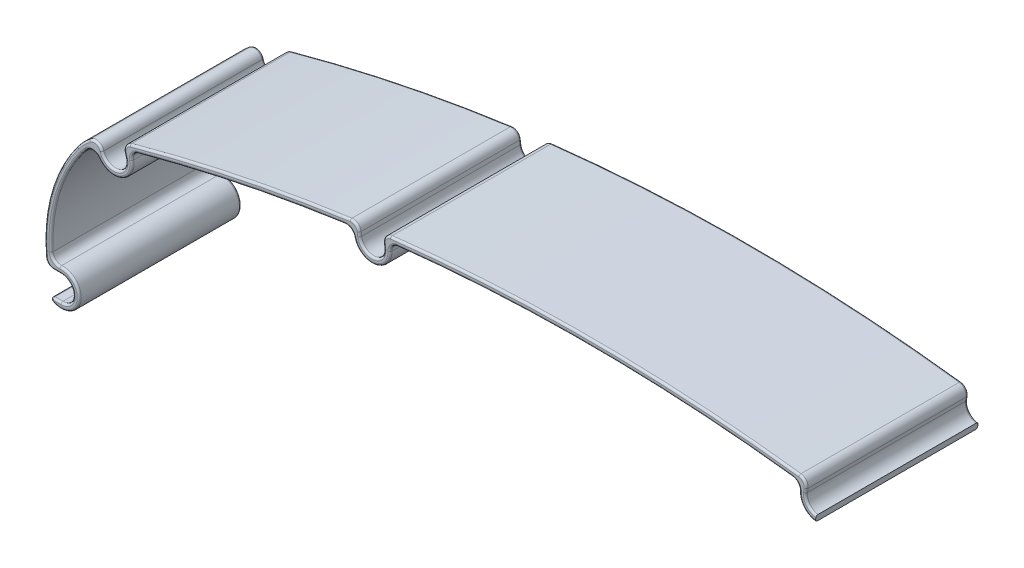
from build123d import *
from build123d.topology import SkipClean

# Parameters (mm, degrees)
EXTRUDE_1_DEPTH     = 40
SKETCH_2_R          = 3
EXTRUDE_1_2_DEPTH   = 40
EXTRUDE_2_DEPTH     = 40
CUT_EXTRUDE_2_DEPTH = 208.592060428
FILLET_1_R          = 2
FILLET_3_R          = 0.5
FILLET_4_R          = 0.5
CUT_EXTRUDE_3_DEPTH = 207.611727306


with BuildPart() as part:
    # ｽｹｯﾁ1 → Extrude 1 (new body)
    with BuildSketch(Plane.XY):
        with BuildLine():
            ThreePointArc((-174.917675812, 6.802025891), (-175.16536545, 24.049389715), (-168.029000204, 39.753058081))
            ThreePointArc((-168.029000204, 39.753058081), (-164.386404751, 43.234236237), (-159.829079223, 45.38316318))
            ThreePointArc((-159.829079223, 45.38316318), (-73.039152779, 60.834071576), (15.071759596, 58.061162838))
            ThreePointArc((15.071759596, 58.061162838), (38.698282136, 56.368912879), (62.348129133, 57.695945012))
            ThreePointArc((62.348129133, 57.695945012), (64.982359088, 58.386614212), (67.332573283, 59.762362967))
            ThreePointArc((67.332573283, 59.762362967), (68.437320119, 60.625078199), (69.547541148, 61.480737248))
            ThreePointArc((69.547541148, 61.480737248), (69.829795591, 61.819116287), (69.939206591, 62.245961901))
            ThreePointArc((69.939206591, 62.245961901), (71.148233251, 64.567309568), (73.719523874, 65.056047728))
            ThreePointArc((73.719523874, 65.056047728), (74.15979094, 65.03780341), (74.565156848, 65.21056459))
            ThreePointArc((74.565156848, 65.21056459), (113.346908434, 87.575280448), (155.853132865, 101.626104486))
            ThreePointArc((155.853132865, 101.626104486), (158.26218824, 101.124572816), (159.485666507, 98.989582711))
            ThreePointArc((159.485666507, 98.989582711), (159.562144442, 78.779630656), (155.859832877, 58.911543179))
            Line((155.859832877, 58.911543179), (154.417522154, 59.323538057))
            ThreePointArc((154.417522154, 59.323538057), (158.068245541, 78.914782698), (157.992833254, 98.843128361))
            ThreePointArc((157.992833254, 98.843128361), (157.38109412, 99.910623413), (156.176566433, 100.161389249))
            ThreePointArc((156.176566433, 100.161389249), (113.960157168, 86.206366284), (75.442826616, 63.994137124))
            ThreePointArc((75.442826616, 63.994137124), (74.429411845, 63.562234175), (73.32874418, 63.607844969))
            ThreePointArc((73.32874418, 63.607844969), (72.043098868, 63.363475889), (71.438585538, 62.202802056))
            ThreePointArc((71.438585538, 62.202802056), (71.165058039, 61.135688021), (70.459421932, 60.289740423))
            ThreePointArc((70.459421932, 60.289740423), (69.356770591, 59.439915413), (68.259556121, 58.583082331))
            ThreePointArc((68.259556121, 58.583082331), (65.556810089, 57.000971383), (62.527445976, 56.206701758))
            ThreePointArc((62.527445976, 56.206701758), (38.68669584, 54.868957627), (14.869458419, 56.574867365))
            ThreePointArc((14.869458419, 56.574867365), (-72.930878607, 59.337984435), (-159.414875998, 43.941485058))
            ThreePointArc((-159.414875998, 43.941485058), (-163.537227688, 41.997749947), (-166.832146939, 38.848877645))
            ThreePointArc((-166.832146939, 38.848877645), (-173.697107608, 23.742438725), (-173.458837906, 7.151012945))
            Line((-173.458837906, 7.151012945), (-174.917675812, 6.802025891))
        make_face()
    extrude(amount=EXTRUDE_1_DEPTH)

    # ｽｹｯﾁ2 → Extrude 1 2 (add, through all)
    with BuildSketch(Plane.XY):
        with Locations((156.5, 98.696674011)):
            Circle(SKETCH_2_R)
        with Locations((152.975211431, 59.735532934)):
            Circle(SKETCH_2_R)
        with Locations((72.937964485, 62.15964221)):
            Circle(SKETCH_2_R)
        with Locations((14.667154113, 55.08857315)):
            Circle(SKETCH_2_R)
        with Locations((-95.332845887, 55.602740192)):
            Circle(SKETCH_2_R)
        with Locations((-159, 42.5)):
            Circle(SKETCH_2_R)
        with Locations((-172, 7.5)):
            Circle(SKETCH_2_R)
    extrude(amount=EXTRUDE_1_2_DEPTH)

    # ｽｹｯﾁ3 → ﾎﾞｽ - 押し出し2 (add, through all)
    with SkipClean():  # the faces are left unmerged after this step: merging them gives an invalid solid
        with BuildSketch(Plane.XY.offset(40)):
            with BuildLine():
                ThreePointArc((155.105149564, 61.848200335), (155.309814131, 62.650779102), (155.508210181, 63.454930376))
                ThreePointArc((155.508210181, 63.454930376), (148.997241196, 57.631785608), (157.475211431, 59.735532934))
                ThreePointArc((157.475211431, 59.735532934), (157.288117426, 61.019605313), (156.742392819, 62.196903362))
                ThreePointArc((156.742392819, 62.196903362), (156.314091206, 60.550736841), (155.859832877, 58.911543179))
                ThreePointArc((155.859832877, 58.911543179), (150.069623581, 58.988834035), (155.105149564, 61.848200335))
            make_face()
            with BuildLine():
                ThreePointArc((156.742392819, 62.196903362), (156.187488729, 62.886925414), (155.508210181, 63.454930376))
                ThreePointArc((155.508210181, 63.454930376), (155.309814131, 62.650779102), (155.105149564, 61.848200335))
                ThreePointArc((155.105149564, 61.848200335), (150.069623581, 58.988834035), (155.859832877, 58.911543179))
                ThreePointArc((155.859832877, 58.911543179), (156.314091206, 60.550736841), (156.742392819, 62.196903362))
            make_face()
            with BuildLine():
                ThreePointArc((153.634250899, 99.584075889), (152.831051821, 99.395038452), (152.028572351, 99.202969162))
                ThreePointArc((152.028572351, 99.202969162), (153.837741702, 95.068674458), (158.324352301, 94.583069912))
                ThreePointArc((158.324352301, 94.583069912), (158.27349835, 95.409770667), (158.216195446, 96.236049458))
                ThreePointArc((158.216195446, 96.236049458), (154.730059706, 96.274420648), (153.634250899, 99.584075889))
            make_face()
            with BuildLine():
                ThreePointArc((70.459421932, 60.289740423), (69.906180844, 59.864751513), (69.354299522, 59.437998327))
                ThreePointArc((69.354299522, 59.437998327), (74.373845341, 57.894874202), (77.437964485, 62.15964221))
                ThreePointArc((77.437964485, 62.15964221), (77.217292333, 63.55153056), (76.576918629, 64.806907354))
                ThreePointArc((76.576918629, 64.806907354), (76.009223863, 64.40142748), (75.442826616, 63.994137124))
                ThreePointArc((75.442826616, 63.994137124), (75.399998918, 63.963913966), (75.356546973, 63.934595379))
                ThreePointArc((75.356546973, 63.934595379), (74.72769572, 59.751974852), (70.541302553, 60.35520003))
                ThreePointArc((70.541302553, 60.35520003), (70.500705388, 60.322041001), (70.459421932, 60.289740423))
            make_face()
            with BuildLine():
                ThreePointArc((12.289483713, 56.91796744), (11.472492469, 57.023256633), (10.655298124, 57.126957688))
                ThreePointArc((10.655298124, 57.126957688), (13.619144559, 50.712310364), (19.167154113, 55.08857315))
                ThreePointArc((19.167154113, 55.08857315), (19.140980955, 55.573210523), (19.062765943, 56.052210345))
                ThreePointArc((19.062765943, 56.052210345), (18.249123765, 56.1461181), (17.435899956, 56.243582438))
                ThreePointArc((17.435899956, 56.243582438), (14.277367269, 52.114003228), (12.289483713, 56.91796744))
            make_face()
            with BuildLine():
                ThreePointArc((-98.102305571, 56.756036796), (-98.918773563, 56.646764089), (-99.735027626, 56.535904666))
                ThreePointArc((-99.735027626, 56.535904666), (-95.801984552, 51.127261568), (-90.832845887, 55.602740192))
                ThreePointArc((-90.832845887, 55.602740192), (-90.951732307, 56.630282793), (-91.302109797, 57.603531678))
                ThreePointArc((-91.302109797, 57.603531678), (-92.120237861, 57.507474522), (-92.938177679, 57.409827398))
                ThreePointArc((-92.938177679, 57.409827398), (-94.956046603, 52.626497208), (-98.102305571, 56.756036796))
            make_face()
            with BuildLine():
                ThreePointArc((-161.968675598, 42.932394718), (-162.736296322, 42.509116787), (-163.47635635, 42.039311575))
                ThreePointArc((-163.47635635, 42.039311575), (-158.769352625, 38.0059148), (-154.5, 42.5))
                ThreePointArc((-154.5, 42.5), (-154.710957632, 43.861659124), (-155.324051364, 45.095650521))
                ThreePointArc((-155.324051364, 45.095650521), (-156.117747866, 44.875181143), (-156.911014356, 44.653169519))
                ThreePointArc((-156.911014356, 44.653169519), (-158.033702901, 39.659882059), (-161.968675598, 42.932394718))
            make_face()
            with BuildLine():
                ThreePointArc((-175.578603832, 10.228295184), (-173.439840747, 3.236567272), (-167.5, 7.5))
                ThreePointArc((-167.5, 7.5), (-169.737135307, 11.389658518), (-174.224197059, 11.411898189))
                ThreePointArc((-174.224197059, 11.411898189), (-174.113884067, 10.579249836), (-173.985166515, 9.74924741))
                ThreePointArc((-173.985166515, 9.74924741), (-169.139756236, 6.595010712), (-174.917675812, 6.802025891))
                ThreePointArc((-174.917675812, 6.802025891), (-175.286049309, 8.50784779), (-175.578603832, 10.228295184))
            make_face()
            with BuildLine():
                ThreePointArc((-173.985166515, 9.74924741), (-174.113884067, 10.579249836), (-174.224197059, 11.411898189))
                ThreePointArc((-174.224197059, 11.411898189), (-174.961140585, 10.888457825), (-175.578603832, 10.228295184))
                ThreePointArc((-175.578603832, 10.228295184), (-175.286049309, 8.50784779), (-174.917675812, 6.802025891))
                ThreePointArc((-174.917675812, 6.802025891), (-169.139756236, 6.595010712), (-173.985166515, 9.74924741))
            make_face()
            with BuildLine():
                ThreePointArc((-174.917675812, 6.802025891), (-169.139756236, 6.595010712), (-173.985166515, 9.74924741))
                ThreePointArc((-173.985166515, 9.74924741), (-173.403193785, 25.035153743), (-166.832146939, 38.848877645))
                ThreePointArc((-166.832146939, 38.848877645), (-164.631459446, 41.165814703), (-161.968675598, 42.932394718))
                ThreePointArc((-161.968675598, 42.932394718), (-158.033702901, 39.659882059), (-156.911014356, 44.653169519))
                ThreePointArc((-156.911014356, 44.653169519), (-127.721253028, 51.747326401), (-98.102305571, 56.756036796))
                ThreePointArc((-98.102305571, 56.756036796), (-94.956046603, 52.626497208), (-92.938177679, 57.409827398))
                ThreePointArc((-92.938177679, 57.409827398), (-40.309022297, 60.442434008), (12.289483713, 56.91796744))
                ThreePointArc((12.289483713, 56.91796744), (14.277367269, 52.114003228), (17.435899956, 56.243582438))
                ThreePointArc((17.435899956, 56.243582438), (39.98055891, 54.863431307), (62.527445397, 56.206701272))
                ThreePointArc((62.527445397, 56.206701272), (65.556809954, 57.000970881), (68.259556248, 58.583082168))
                ThreePointArc((68.259556248, 58.583082168), (69.356770591, 59.439915413), (70.459421932, 60.289740423))
                ThreePointArc((70.459421932, 60.289740423), (70.500705388, 60.322041001), (70.541302553, 60.35520003))
                ThreePointArc((70.541302553, 60.35520003), (74.72769572, 59.751974852), (75.356546973, 63.934595379))
                ThreePointArc((75.356546973, 63.934595379), (75.399998918, 63.963913966), (75.442826616, 63.994137124))
                ThreePointArc((75.442826616, 63.994137124), (112.772142039, 85.669896417), (153.634250899, 99.584075889))
                ThreePointArc((153.634250899, 99.584075889), (154.730059706, 96.274420648), (158.216195446, 96.236049458))
                ThreePointArc((158.216195446, 96.236049458), (158.068245541, 78.914782698), (155.105149564, 61.848200335))
                ThreePointArc((155.105149564, 61.848200335), (150.069623581, 58.988834035), (155.859832877, 58.911543179))
                ThreePointArc((155.859832877, 58.911543179), (159.562144442, 78.779630656), (159.485666507, 98.989582711))
                ThreePointArc((159.485666507, 98.989582711), (158.26218824, 101.124572816), (155.853132865, 101.626104486))
                ThreePointArc((155.853132865, 101.626104486), (113.346908434, 87.575280448), (74.565156848, 65.21056459))
                ThreePointArc((74.565156848, 65.21056459), (74.15979094, 65.03780341), (73.719523874, 65.056047728))
                ThreePointArc((73.719523874, 65.056047728), (71.148233251, 64.567309568), (69.939206591, 62.245961901))
                ThreePointArc((69.939206591, 62.245961901), (69.829795591, 61.819116287), (69.547541148, 61.480737248))
                ThreePointArc((69.547541148, 61.480737248), (68.437320119, 60.625078199), (67.332573283, 59.762362967))
                ThreePointArc((67.332573283, 59.762362967), (64.982359088, 58.386614212), (62.348129133, 57.695945012))
                ThreePointArc((62.348129133, 57.695945012), (38.698282167, 56.368913497), (15.07175968, 58.061163451))
                ThreePointArc((15.07175968, 58.061163451), (-73.039152866, 60.83407219), (-159.829079451, 45.383163973))
                ThreePointArc((-159.829079451, 45.383163973), (-164.386405219, 43.234236917), (-168.029000204, 39.753058081))
                ThreePointArc((-168.029000204, 39.753058081), (-175.16536545, 24.049389715), (-174.917675812, 6.802025891))
            make_face()
        extrude(amount=-EXTRUDE_2_DEPTH)
    add(part.part.scale(1), mode=Mode.REPLACE)  # the faces are merged on a copy

    # ｽｹｯﾁ4 → ｶｯﾄ - 押し出し2 (cut, through all)
    with BuildSketch(Plane.XY.offset(40)):
        with BuildLine():
            Line((-161.881126724, 41.663872737), (-162.717256801, 44.545009155))
            ThreePointArc((-162.717256801, 44.545009155), (-160.67225734, 48.262263142), (-156.955003353, 46.217263682))
            Line((-156.955003353, 46.217263682), (-156.118873276, 43.336127263))
            ThreePointArc((-156.118873276, 43.336127263), (-158.163872737, 39.618873276), (-161.881126724, 41.663872737))
        make_face()
        with BuildLine():
            Line((-172, 4.5), (-176.5, 4.5))
            ThreePointArc((-176.5, 4.5), (-179.5, 7.5), (-176.5, 10.5))
            Line((-176.5, 10.5), (-172, 10.5))
            ThreePointArc((-172, 10.5), (-169, 7.5), (-172, 4.5))
        make_face()
        with BuildLine():
            Line((-98.309088871, 55.225940908), (-98.685888052, 58.202183073))
            ThreePointArc((-98.685888052, 58.202183073), (-96.086444352, 61.555225341), (-92.733402084, 58.955781642))
            Line((-92.733402084, 58.955781642), (-92.356602903, 55.979539476))
            ThreePointArc((-92.356602903, 55.979539476), (-94.956046603, 52.626497208), (-98.309088871, 55.225940908))
        make_face()
        with BuildLine():
            Line((11.694563608, 55.493178744), (12.099169116, 58.465768619))
            ThreePointArc((12.099169116, 58.465768619), (15.476365216, 61.03375353), (18.044350127, 57.65655743))
            Line((18.044350127, 57.65655743), (17.639744618, 54.683967555))
            ThreePointArc((17.639744618, 54.683967555), (14.262548518, 52.115982644), (11.694563608, 55.493178744))
        make_face()
        with BuildLine():
            Line((70.530297127, 60.369910976), (68.740565893, 62.777578334))
            ThreePointArc((68.740565893, 62.777578334), (69.358502016, 66.974976927), (73.555900609, 66.357040803))
            Line((73.555900609, 66.357040803), (75.345631843, 63.949373445))
            ThreePointArc((75.345631843, 63.949373445), (74.72769572, 59.751974852), (70.530297127, 60.369910976))
        make_face()
        with BuildLine():
            Line((154.072101195, 100.458862251), (155.834289436, 102.886761056))
            ThreePointArc((155.834289436, 102.886761056), (160.024376481, 103.55247162), (160.690087045, 99.362384575))
            Line((160.690087045, 99.362384575), (158.927898805, 96.934485771))
            ThreePointArc((158.927898805, 96.934485771), (154.73781176, 96.268775206), (154.072101195, 100.458862251))
        make_face()
        with BuildLine():
            Line((152.975211431, 62.735532934), (157.475211431, 62.735532934))
            ThreePointArc((157.475211431, 62.735532934), (160.475211431, 59.735532934), (157.475211431, 56.735532934))
            Line((157.475211431, 56.735532934), (152.975211431, 56.735532934))
            ThreePointArc((152.975211431, 56.735532934), (149.975211431, 59.735532934), (152.975211431, 62.735532934))
        make_face()
    extrude(amount=-CUT_EXTRUDE_2_DEPTH, mode=Mode.SUBTRACT)

    # ﾌｨﾚｯﾄ1
    fillet_1_edges = [part.edges().sort_by_distance(p)[0] for p in [
        (-174.224197059, 11.411898189, 20),
        (-155.324051364, 45.095650521, 20),
        (-99.735027626, 56.535904666, 20),
        (-91.302109797, 57.603531678, 20),
        (10.655298124, 57.126957688, 20),
        (19.062765943, 56.052210345, 20),
        (69.354299522, 59.437998327, 20),
        (76.576918629, 64.806907354, 20),
        (152.028572351, 99.202969162, 20),
        (158.324352301, 94.583069912, 20),
        (155.508210181, 63.454930376, 20),
        (156.876524055, 62.735532934, 20),
        (159.591463431, 97.848728486, 20),
        (154.738438299, 101.376924818, 20),
        (74.458181594, 65.14323147, 20),
        (69.642846878, 61.563769001, 20),
        (18.047519346, 57.680566039, 20),
        (12.0977422, 58.455285231, 20),
        (-92.732073243, 58.945285465, 20),
        (-98.684559207, 58.191686864, 20),
        (-156.950021623, 46.200097642, 20),
        (-162.638748681, 44.274485931, 20),
        (-175.617677363, 10.5, 20),
        (-163.47635635, 42.039311575, 20),
    ]]
    fillet(fillet_1_edges, radius=FILLET_1_R)

    # ﾌｨﾚｯﾄ3
    fillet_3_edges = [part.edges().sort_by_distance(p)[0] for p in [
        (-175.354101966, 4.5, 20),
        (156.329313397, 56.735532934, 20),
    ]]
    fillet(fillet_3_edges, radius=FILLET_3_R)

    # ﾌｨﾚｯﾄ4
    fillet_4_edges = [part.edges().sort_by_distance(p)[0] for p in [
        (-172.852772551, 27.036503028, 40),
        (-172.852772551, 27.036503028, 0),
        (-174.496755599, 26.76353818, 40),
        (64.982359088, 58.386614212, 40),
        (41.171934255, 56.366268849, 40),
        (37.32663542, 54.884402397, 40),
        (-156.25241115, 43.796271973, 40),
        (-158.163872737, 39.618873276, 40),
        (-156.25241115, 43.796271973, 0),
        (-158.163872737, 39.618873276, 0),
        (-172.919038538, 10.5, 0),
        (-172.919038538, 10.5, 40),
        (-169, 7.5, 40),
        (-169, 7.5, 0),
        (-92.4175483, 56.460931868, 40),
        (-94.956046603, 52.626497208, 40),
        (-92.4175483, 56.460931868, 0),
        (-94.956046603, 52.626497208, 0),
        (14.262548518, 52.115982644, 40),
        (17.711667491, 55.212376579, 40),
        (14.262548518, 52.115982644, 0),
        (17.711667491, 55.212376579, 0),
        (149.975211431, 59.735532934, 40),
        (153.943457268, 56.735532934, 40),
        (149.975211431, 59.735532934, 0),
        (153.943457268, 56.735532934, 0),
        (-157.222222844, 38.366054139, 40),
        (-157.222222844, 38.366054139, 0),
        (-127.7212524, 51.747326519, 0),
        (-127.7212524, 51.747326519, 40),
        (-94.85985575, 51.127666971, 40),
        (-94.85985575, 51.127666971, 0),
        (-40.309022297, 60.442434008, 0),
        (-40.309022297, 60.442434008, 40),
        (14.115637874, 50.62249771, 40),
        (14.115637874, 50.62249771, 0),
        (65.429568152, 56.949108434, 40),
        (65.429568152, 56.949108434, 0),
        (75.621371199, 58.547256792, 40),
        (75.621371199, 58.547256792, 0),
        (112.400183249, 85.500173809, 0),
        (112.400183249, 85.500173809, 40),
        (153.827551561, 95.076174137, 40),
        (153.827551561, 95.076174137, 0),
        (158.068245541, 78.914782698, 0),
        (158.068245541, 78.914782698, 40),
        (148.538237858, 58.985022768, 40),
        (148.538237858, 58.985022768, 0),
        (159.585920071, 79.046123951, 0),
        (159.585920071, 79.046123951, 40),
        (-166.634814433, 41.359610926, 0),
        (-161.890971039, 41.697794272, 0),
        (-128.024778685, 53.216297373, 0),
        (-98.370034264, 55.707333273, 0),
        (-40.302010998, 61.942418726, 0),
        (11.760006542, 55.973980411, 0),
        (67.692381882, 60.044588841, 0),
        (74.72769572, 59.751974852, 0),
        (111.949802025, 86.943547277, 0),
        (154.723182233, 96.279461024, 0),
        (154.13630839, 62.735532934, 0),
        (-166.307123073, 39.502792681, 0),
        (-175.18499823, 11.021553718, 0),
        (-163.196649172, 43.074160345, 0),
        (-156.21061286, 45.790321687, 0),
        (-99.199108533, 57.525374806, 0),
        (-92.067706458, 58.428226942, 0),
        (11.428570831, 57.944459992, 0),
        (18.533672833, 57.046818746, 0),
        (69.440025994, 60.742330955, 0),
        (75.303219572, 65.100715699, 0),
        (152.715168975, 100.150386551, 0),
        (159.026732407, 95.51117627, 0),
        (156.542606194, 63.17045311, 0),
        (154.13630839, 62.735532934, 40),
        (-166.307123073, 39.502792681, 40),
        (154.723182233, 96.279461024, 40),
        (111.949802025, 86.943547277, 40),
        (74.72769572, 59.751974852, 40),
        (67.692381882, 60.044588841, 40),
        (11.760006542, 55.973980411, 40),
        (-40.302010998, 61.942418726, 40),
        (-98.370034264, 55.707333273, 40),
        (-128.024778685, 53.216297373, 40),
        (-161.890971039, 41.697794272, 40),
        (-166.634814433, 41.359610926, 40),
        (-175.18499823, 11.021553718, 40),
        (-163.196649172, 43.074160345, 40),
        (-156.21061286, 45.790321687, 40),
        (-99.199108533, 57.525374806, 40),
        (-92.067706458, 58.428226942, 40),
        (11.428570831, 57.944459992, 40),
        (18.533672833, 57.046818746, 40),
        (69.440025994, 60.742330955, 40),
        (75.303219572, 65.100715699, 40),
        (152.715168975, 100.150386551, 40),
        (159.026732407, 95.51117627, 40),
        (156.542606194, 63.17045311, 40),
        (-173.768568414, 12.485677184, 40),
        (-173.768568414, 12.485677184, 0),
        (-154.322969262, 44.816153309, 40),
        (-154.322969262, 44.816153309, 0),
        (-100.544388476, 55.883817911, 40),
        (-100.544388476, 55.883817911, 0),
        (-90.355778022, 57.17371948, 40),
        (-90.355778022, 57.17371948, 0),
        (9.704989693, 56.706010853, 40),
        (9.704989693, 56.706010853, 0),
        (19.853694224, 55.435635153, 40),
        (19.853694224, 55.435635153, 0),
        (69.202538318, 58.814048447, 40),
        (69.202538318, 58.814048447, 0),
        (77.227575415, 64.793075978, 40),
        (77.227575415, 64.793075978, 0),
        (151.279758761, 98.466578224, 40),
        (64.982359088, 58.386614212, 0),
        (151.279758761, 98.466578224, 0),
        (157.829689409, 93.629137307, 40),
        (157.829689409, 93.629137307, 0),
        (155.19278095, 64.482151477, 40),
        (155.19278095, 64.482151477, 0),
        (-164.153767397, 40.733981209, 40),
        (-164.153767397, 40.733981209, 0),
        (-174.496755599, 26.76353818, 0),
        (41.171934255, 56.366268849, 0),
        (-169.714555743, 3.623565485, 0),
        (-172.968245837, 4.5, 0),
        (-174.420614591, 4.125, 0),
        (155.395826022, 56.360532934, 0),
        (-172.968245837, 4.5, 40),
        (-169.714555743, 3.623565485, 40),
        (-174.420614591, 4.125, 40),
        (155.395826022, 56.360532934, 40),
        (37.32663542, 54.884402397, 0),
    ]]
    fillet(fillet_4_edges, radius=FILLET_4_R)

    # ｽｹｯﾁ5 → ｶｯﾄ - 押し出し3 (cut, through all)
    with BuildSketch(Plane(origin=(0, 0, 0), x_dir=(-1, 0, 0), z_dir=(0, 0, -1))):
        with BuildLine():
            Line((-14.115638044, 50.622497688), (-14.667154113, 55.08857315))
            Line((-14.667154113, 55.08857315), (-15.690627539, 63.37647229))
            add(Edge.make_bspline(
                [(-15.690627539, 63.37647229), (-26.710996907, 153.476621952), (-87.859875404, 129.195915277), (-204.785780803, 142.54910345), (-203.951599355, 58.262188782), (-165.074912982, -2.747551459), (-93.711107155, 21.30175806), (-11.527533736, 19.740542735), (-14.115638044, 50.622497688)],
                knots=[0, 0, 0, 0, 0.289771918, 0.425049621, 0.577950463, 0.665809797, 0.824629462, 1, 1, 1, 1], degree=3))
        make_face()
    extrude(amount=-CUT_EXTRUDE_3_DEPTH, mode=Mode.SUBTRACT)


solid = part.part
